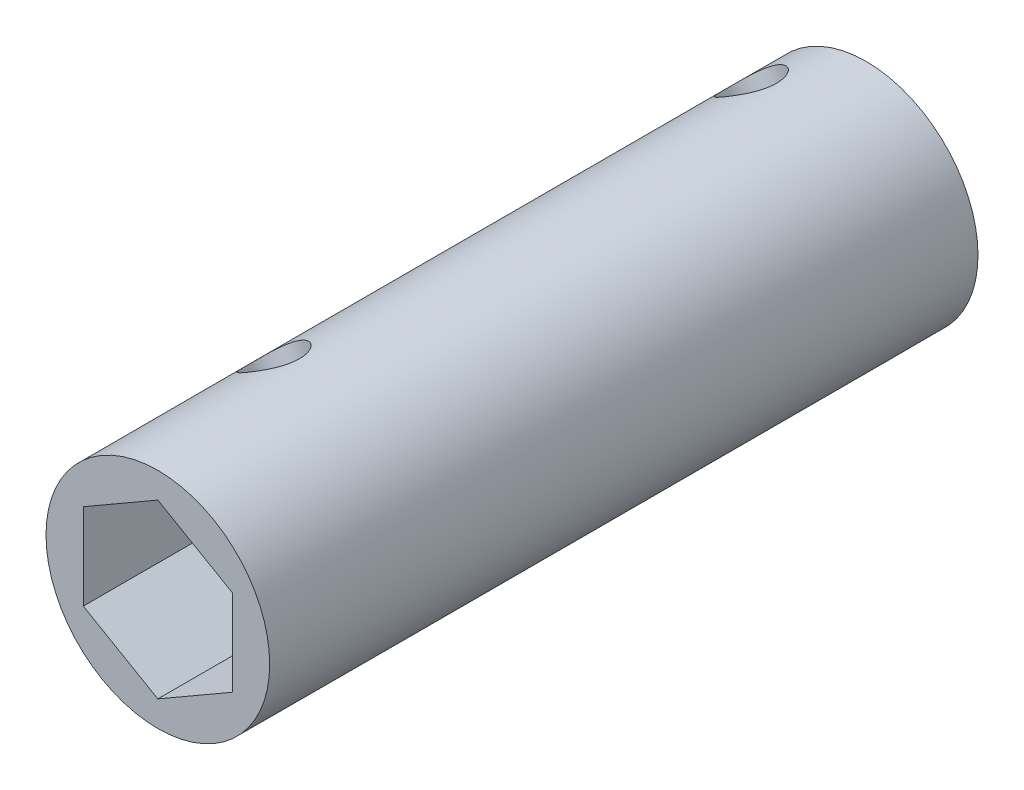
from build123d import *

# Parameters (mm, degrees)
SKETCH1_R               = 9.525
BOSS_EXTRUDE1_DEPTH     = 60.325
CUT_EXTRUDE1_DEPTH      = 65.716102786
CUT_EXTRUDE1_DEPTH_BACK = 65.716102786
SKETCH3_R               = 2.38125


with BuildPart() as part:
    # Sketch1 → Boss-Extrude1 (new body)
    with BuildSketch(Plane.XY):
        Circle(SKETCH1_R)
        Polygon((6.35, 3.666174209), (0, 7.332348419), (-6.35, 3.666174209), (-6.35, -3.666174209), (0, -7.332348419), (6.35, -3.666174209), align=None, mode=Mode.SUBTRACT)
    extrude(amount=BOSS_EXTRUDE1_DEPTH)

    # Sketch3 → Cut-Extrude1 (cut, two sides: drawn at the far end of the back side and taken through both)
    with BuildSketch(Plane(origin=(5.08, -8.798818102, 0), x_dir=(0.8660254037844388, 0.4999999999999997, 0), z_dir=(-0.49999999999999983, 0.8660254037844389, 0)).offset(-CUT_EXTRUDE1_DEPTH_BACK)):
        with Locations((0, -5.08)):
            Circle(SKETCH3_R)
        with Locations((0, -45.72)):
            Circle(SKETCH3_R)
    extrude(amount=CUT_EXTRUDE1_DEPTH + CUT_EXTRUDE1_DEPTH_BACK, mode=Mode.SUBTRACT)


solid = part.part
